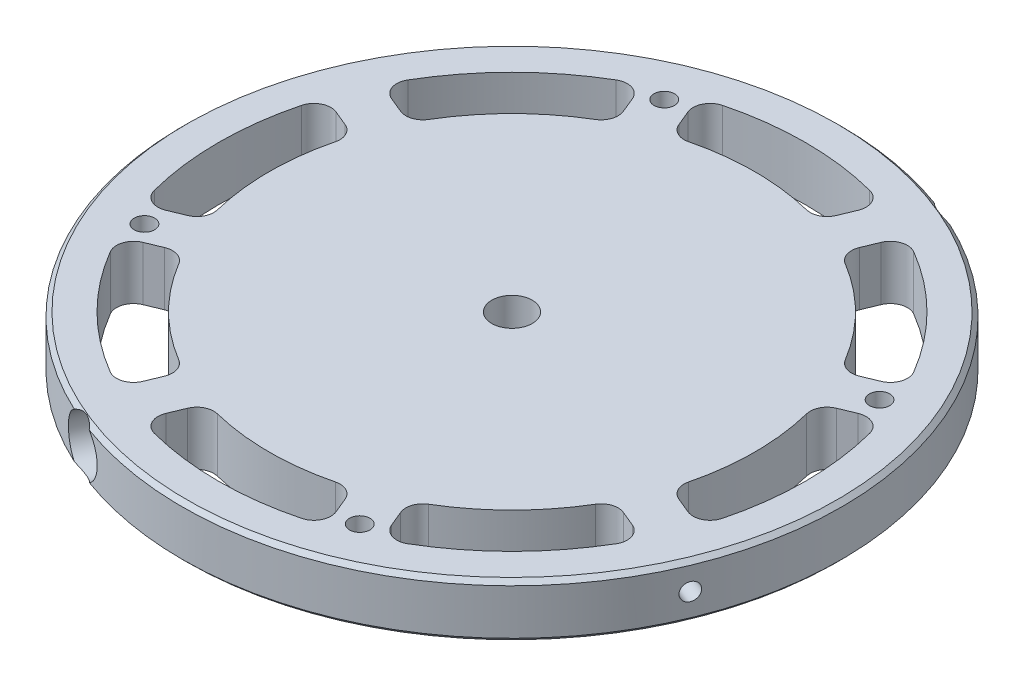
from build123d import *

# Parameters (mm, degrees)
SKETCH2_W                   = 77.55
SKETCH2_H                   = 12.7
F_12_0_189_DIAMETER_HOLE1_D = 4.8006
CIRPATTERN3_COUNT           = 4
CUT_EXTRUDE1_DEPTH          = 111.405140279
FILLET1_R                   = 4
CIRPATTERN4_COUNT           = 8
FILLET1_OF_CIRPATTERN4_R    = 4
CHAMFER1_SIZE               = 1
SKETCH15_W                  = 2.0447
SKETCH15_H                  = 101.323957926
SKETCH19_R                  = 6.25
CUT_EXTRUDE3_DEPTH          = 5
CIRPATTERN5_COUNT           = 2
CIRPATTERN6_COUNT           = 2
SKETCH22_R                  = 4.765
CUT_EXTRUDE4_DEPTH          = 12.8


with BuildPart() as part:
    # Sketch2 → Revolve1 (revolve)
    with BuildSketch(Plane(origin=(0, 0, 0), x_dir=(0, 0, -1), z_dir=(1, 0, 0))):
        with Locations((-38.775, 6.35)):
            Rectangle(SKETCH2_W, SKETCH2_H)
    revolve(axis=Axis((0, -0.888756804, 0), (0, 1, 0)))

    # #12 (0.189) Diameter Hole1 (through all)
    with Locations(Plane(origin=(0, 12.7, 0), x_dir=(1, 0, 0), z_dir=(0, 1, 0))):
        with Locations((-25.333643223, 61.160825052)):
            f_12_0_189_diameter_hole1 = Hole(F_12_0_189_DIAMETER_HOLE1_D / 2)

    # CirPattern3: #12 (0.189) Diameter Hole1 ×4 about axis
    cirpattern3_axis = Axis((0, -0.888756804, 0), (0, 1, 0))
    for i in range(1, CIRPATTERN3_COUNT):
        add(f_12_0_189_diameter_hole1.rotate(cirpattern3_axis, i * 360 / CIRPATTERN3_COUNT), mode=Mode.SUBTRACT)

    # Sketch8 → Cut-Extrude1 (cut, through all)
    with BuildSketch(Plane(origin=(0, 12.7, 0), x_dir=(1, 0, 0), z_dir=(0, 1, 0))):
        with BuildLine():
            Line((-17.167098173, 54.510670885), (-21.735525784, 65.539830782))
            ThreePointArc((-21.735525784, 65.539830782), (0, 69.05), (21.735525784, 65.539830782))
            Line((21.735525784, 65.539830782), (17.167098173, 54.510670885))
            ThreePointArc((17.167098173, 54.510670885), (0, 57.15), (-17.167098173, 54.510670885))
        make_face()
    cut_extrude1 = extrude(amount=-CUT_EXTRUDE1_DEPTH, mode=Mode.SUBTRACT)

    # Fillet1
    fillet1_edges = [part.edges().sort_by_distance(p)[0] for p in [
        (17.167098173, 6.35, -54.510670885),
        (21.735525784, 6.35, -65.539830782),
        (-17.167098173, 6.35, -54.510670885),
        (-21.735525784, 6.35, -65.539830782),
    ]]
    fillet(fillet1_edges, radius=FILLET1_R)

    # CirPattern4: Cut-Extrude1 ×8 about axis
    cirpattern4_axis = Axis((0, -0.888756804, 0), (0, 1, 0))
    for i in range(1, CIRPATTERN4_COUNT):
        add(cut_extrude1.rotate(cirpattern4_axis, i * 360 / CIRPATTERN4_COUNT), mode=Mode.SUBTRACT)

    # Fillet1 of CirPattern4
    fillet1_of_cirpattern4_edges = [part.edges().sort_by_distance(p)[0] for p in [
        (-26.405893498, 6.35, -50.683836561),
        (-30.974321109, 6.35, -61.712996458),
        (-50.683836561, 6.35, -26.405893498),
        (-61.712996458, 6.35, -30.974321109),
        (-54.510670885, 6.35, -17.167098173),
        (-65.539830782, 6.35, -21.735525784),
        (-54.510670885, 6.35, 17.167098173),
        (-65.539830782, 6.35, 21.735525784),
        (-50.683836561, 6.35, 26.405893498),
        (-61.712996458, 6.35, 30.974321109),
        (-26.405893498, 6.35, 50.683836561),
        (-30.974321109, 6.35, 61.712996458),
        (-17.167098173, 6.35, 54.510670885),
        (-21.735525784, 6.35, 65.539830782),
        (17.167098173, 6.35, 54.510670885),
        (21.735525784, 6.35, 65.539830782),
        (26.405893498, 6.35, 50.683836561),
        (30.974321109, 6.35, 61.712996458),
        (50.683836561, 6.35, 26.405893498),
        (61.712996458, 6.35, 30.974321109),
        (54.510670885, 6.35, 17.167098173),
        (65.539830782, 6.35, 21.735525784),
        (54.510670885, 6.35, -17.167098173),
        (65.539830782, 6.35, -21.735525784),
        (50.683836561, 6.35, -26.405893498),
        (61.712996458, 6.35, -30.974321109),
        (26.405893498, 6.35, -50.683836561),
        (30.974321109, 6.35, -61.712996458),
    ]]
    fillet(fillet1_of_cirpattern4_edges, radius=FILLET1_OF_CIRPATTERN4_R)

    # Chamfer1
    chamfer1_edges = [part.edges().sort_by_distance(p)[0] for p in [
        (0, 0, -77.55),
        (0, 12.7, -77.55),
    ]]
    chamfer(chamfer1_edges, length=CHAMFER1_SIZE)

    # Sketch15 → #20 (0.161) Diameter Hole1 (revolve, cut)
    with BuildSketch(Plane(origin=(0, 6.35, 0), x_dir=(-0.38268343236508734, 0, 0.9238795325112877), z_dir=(0, 1, 0))):
        with Locations((1.02235, 50.661978963)):
            Rectangle(SKETCH15_W, SKETCH15_H)
    revolve(axis=Axis((-5.866635031, 6.35, -2.430039796), (0.9238795325112877, 0, 0.3826834323650874)), mode=Mode.SUBTRACT)

    # Sketch19 → Cut-Extrude3 (cut)
    with BuildSketch(Plane(origin=(29.67710018, 0, -71.646857746), x_dir=(-0.9238795325112891, 0, -0.38268343236508423), z_dir=(0.38268343236508423, 0, -0.9238795325112891))):
        with Locations((0, 6.35)):
            Circle(SKETCH19_R)
    cut_extrude3 = extrude(amount=-CUT_EXTRUDE3_DEPTH, mode=Mode.SUBTRACT)

    # CirPattern5: Cut-Extrude3 ×2 about axis
    cirpattern5_axis = Axis((0, -0.888756804, 0), (0, 1, 0))
    for i in range(1, CIRPATTERN5_COUNT):
        add(cut_extrude3.rotate(cirpattern5_axis, i * 360 / CIRPATTERN5_COUNT), mode=Mode.SUBTRACT)

    # Sketch21 → #10-24 Tapped Hole1 (revolve, cut)
    with BuildSketch(Plane(origin=(-27.763683018, 6.35, 67.027460084), x_dir=(0.9238795325112891, 0, 0.38268343236508423), z_dir=(0, 1, 0))):
        Polygon((0, 0), (0, 51.940824014), (1.89865, 50.8), (1.89865, 0), align=None)
    f_10_24_tapped_hole1 = revolve(axis=Axis((-30.193722814, 6.35, 72.894095115), (0.38268343236508423, 0, -0.923879532511289)), mode=Mode.SUBTRACT)

    # CirPattern6: #10-24 Tapped Hole1 ×2 about axis
    cirpattern6_axis = Axis((0, -0.888756804, 0), (0, 1, 0))
    for i in range(1, CIRPATTERN6_COUNT):
        add(f_10_24_tapped_hole1.rotate(cirpattern6_axis, i * 360 / CIRPATTERN6_COUNT), mode=Mode.SUBTRACT)

    # Sketch22 → Cut-Extrude4 (cut)
    with BuildSketch(Plane(origin=(0, 12.7, 0), x_dir=(1, 0, 0), z_dir=(0, 1, 0))):
        Circle(SKETCH22_R)
    extrude(amount=-CUT_EXTRUDE4_DEPTH, mode=Mode.SUBTRACT)


solid = part.part
